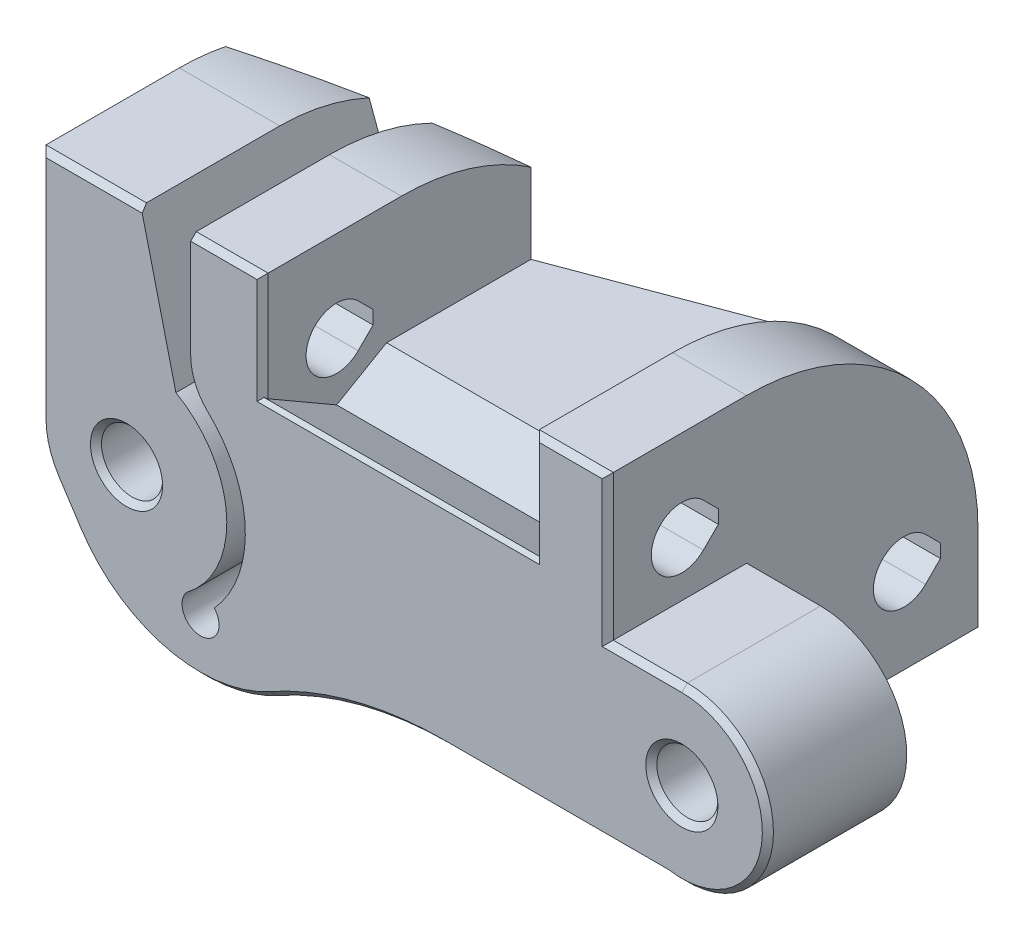
from build123d import *
from OCP.BRepFilletAPI import BRepFilletAPI_MakeChamfer

# Parameters (mm, degrees)
SKETCH1_R                = 1.65
BOSS_EXTRUDE1_DEPTH      = 20
SKETCH3_R                = 1.65
CUT_EXTRUDE3_DEPTH       = 39.673925324
CUT_EXTRUDE4_DEPTH       = 12
CUT_EXTRUDE5_START       = -4
CUT_EXTRUDE5_DEPTH       = 14.65
CUT_EXTRUDE11_DEPTH      = 42.915062925
CUT_EXTRUDE11_DEPTH_BACK = 42.915062925
CUT_EXTRUDE10_DEPTH      = 5
CUT_EXTRUDE10_DEPTH_BACK = 39.898875305
SKETCH10_W               = 9.115200733
SKETCH10_H               = 9.576012389
CUT_EXTRUDE7_DEPTH       = 4.5
CUT_EXTRUDE8_DEPTH       = 36.587532929
CUT_EXTRUDE8_DEPTH_BACK  = 36.587532929
SKETCH8_R                = 1.65
CUT_EXTRUDE9_START       = 2
SKETCH9_R                = 3.5
CUT_EXTRUDE9_DEPTH       = 34.587532929
CHAMFER6_SIZE            = 1.8
CUT_EXTRUDE12_DEPTH      = 39.673925324
CHAMFER7_SIZE            = 0.3
CHAMFER7_SIZE2           = 0.219615242
CUT_EXTRUDE13_DEPTH      = 42.915062925
SKETCH14_R               = 3.1
CUT_EXTRUDE14_DEPTH      = 1.8
CHAMFER8_START           = -4.6500001
CHAMFER8_OUTLINE_R       = 3.1
CHAMFER8_DEPTH           = 1.8000001
CHAMFER8_START_2         = -4.65
CHAMFER8_3_DEPTH         = 1.8
FILLET1_R                = 3


with BuildPart() as part:
    # Sketch1 → Boss-Extrude1 (new body)
    with BuildSketch(Plane.XY):
        with BuildLine():
            Line((-3.894375, -2.540933561), (-2.7, -4.371498599))
            ThreePointArc((-2.7, -4.371498599), (2.076657931, -7.765356095), (7.885150706, -6.993254178))
            ThreePointArc((7.885150706, -6.993254178), (12.369935761, -5.200285461), (17.161085198, -4.589612979))
            Line((17.161085198, -4.589612979), (29.253037683, -4.589612979))
            ThreePointArc((29.253037683, -4.589612979), (34.634878658, -0.374699645), (30, 4.65))
            Line((30, 4.65), (26, 4.65))
            Line((26, 4.65), (26, 12.5))
            Line((26, 12.5), (-4.65, 12.5))
            Line((-4.65, 12.5), (-4.65, 0))
            ThreePointArc((-4.65, 0), (-4.457092312, -1.325453932), (-3.894375, -2.540933561))
        make_face()
        Circle(SKETCH1_R, mode=Mode.SUBTRACT)
        with Locations((30, 0)):
            Circle(SKETCH1_R, mode=Mode.SUBTRACT)
    extrude(amount=BOSS_EXTRUDE1_DEPTH)

    # Sketch3 → Cut-Extrude3 (cut, through all)
    with BuildSketch(Plane(origin=(26, 0, 0), x_dir=(0, 0, -1), z_dir=(1, 0, 0))):
        with Locations(Location((-16, 7.6, 0), (0, 0, 90))):
            Circle(SKETCH3_R)
    extrude(amount=-CUT_EXTRUDE3_DEPTH, mode=Mode.SUBTRACT)

    # Sketch4 → Cut-Extrude4 (cut)
    with BuildSketch(Plane(origin=(0, 0, 0), x_dir=(-1, 0, 0), z_dir=(0, 0, -1))):
        Polygon((1.58771324, -2.75), (6.896922601, -2.75), (6.896922601, 2.75), (1.58771324, 2.75), (-1.58771324, 2.75), (-3.175426481, 0), (-1.58771324, -2.75), align=None)
    extrude(amount=-CUT_EXTRUDE4_DEPTH, mode=Mode.SUBTRACT)

    # Sketch5 → Cut-Extrude5 (cut)
    with BuildSketch(Plane(origin=(26, 0, 0), x_dir=(0, 0, -1), z_dir=(1, 0, 0)).offset(CUT_EXTRUDE5_START)):
        Polygon((-13.3, 6.041154273), (0, 6.041154273), (0, 12.5), (-20, 13.02709253), (-20, 6.791709623), (-16, 4.482308546), align=None)
    extrude(amount=-CUT_EXTRUDE5_DEPTH, mode=Mode.SUBTRACT)

    # Sketch11 → Cut-Extrude11 (cut, two sides: drawn at the far end of the back side and taken through both)
    with BuildSketch(Plane(origin=(0, 0, 0), x_dir=(1, 0, 0), z_dir=(0, 1, 0)).offset(-CUT_EXTRUDE11_DEPTH_BACK)):
        Polygon((22, 0), (-4.65, -10), (-4.65, 0), align=None)
    extrude(amount=CUT_EXTRUDE11_DEPTH + CUT_EXTRUDE11_DEPTH_BACK, mode=Mode.SUBTRACT)

    # Sketch10 → Cut-Extrude10 (cut, two sides: drawn at the far end of the back side and taken through both)
    with BuildSketch(Plane.XY.offset(7.5).offset(-CUT_EXTRUDE10_DEPTH_BACK)):
        with Locations((30.557600367, -0.138006194)):
            Rectangle(SKETCH10_W, SKETCH10_H)
    extrude(amount=CUT_EXTRUDE10_DEPTH + CUT_EXTRUDE10_DEPTH_BACK, mode=Mode.SUBTRACT)

    # Sketch7 → Cut-Extrude7 (cut)
    with BuildSketch(Plane(origin=(0, 0, 12.5), x_dir=(-1, 0, 0), z_dir=(0, 0, -1))):
        Polygon((-27.2, -1.616580754), (-27.2, 1.616580754), (-30, 3.233161507), (-32.8, 1.616580754), (-32.8, -1.616580754), (-30, -3.233161507), align=None)
    extrude(amount=-CUT_EXTRUDE7_DEPTH, mode=Mode.SUBTRACT)

    # Sketch8 → Cut-Extrude8 (cut, two sides: drawn at the far end of the back side and taken through both)
    with BuildSketch(Plane.ZY.offset(-22).offset(-CUT_EXTRUDE8_DEPTH_BACK)):
        with Locations((4, 0)):
            Circle(SKETCH8_R)
        with BuildLine():
            Line((12.5, 12.5), (0, 12.5))
            Line((0, 12.5), (0, 0))
            ThreePointArc((0, 0), (3.661165235, 8.838834765), (12.5, 12.5))
        make_face()
    extrude(amount=CUT_EXTRUDE8_DEPTH + CUT_EXTRUDE8_DEPTH_BACK, mode=Mode.SUBTRACT)

    # Sketch9 → Cut-Extrude9 (cut, through all)
    with BuildSketch(Plane.ZY.offset(-22).offset(CUT_EXTRUDE9_START)):
        with Locations((4, 0)):
            Circle(SKETCH9_R)
    extrude(amount=CUT_EXTRUDE9_DEPTH, mode=Mode.SUBTRACT)

    # Chamfer6
    # the kernel refuses this chamfer: 1.8 mm, written as the material it takes off along each edge
    with BuildSketch(Plane(origin=(20, 0, 4), x_dir=(0, 0, 1), z_dir=(0, -1, 0))) as chamfer6_piece_1:
        Polygon((1.65, -CHAMFER6_SIZE), (1.65 + CHAMFER6_SIZE, 0), (1.65, 0), align=None)
    revolve(axis=Axis((20, 0, 4), (-1, 0, 0)), mode=Mode.SUBTRACT)

    # Sketch12 → Cut-Extrude12 (cut, through all)
    with BuildSketch(Plane(origin=(26, 0, 0), x_dir=(0, 0, -1), z_dir=(1, 0, 0))):
        Polygon((-4, 0), (-2.833273811, -1.166726189), (-2.03, -0.363452378), (-2.03, 0.363452378), (-2.833273811, 1.166726189), align=None)
        Polygon((-16, 7.6), (-14.833273811, 6.433273811), (-14.03, 7.236547622), (-14.03, 7.963452378), (-14.833273811, 8.766726189), align=None)
    extrude(amount=-CUT_EXTRUDE12_DEPTH, mode=Mode.SUBTRACT)

    # Chamfer7: one chamfer whose edges measure the first distance from different faces: ONE call of the kernel's chamfer builder (chamfer() names one face for all edges)
    chamfer7_edges_1 = [part.edges().sort_by_distance(p)[0] for p in [
        (-4.457092312, -1.325453932, 20),
        (-3.2971875, -3.45621608, 20),
        (2.076657931, -7.765356095, 20),
        (12.369935761, -5.200285461, 20),
        (23.207061441, -4.589612979, 20),
        (34.634878658, -0.374699645, 20),
        (-1.65, 0, 20),
        (28, 4.65, 20),
        (28.35, 0, 20),
        (26, 8.575, 20),
        (24, 12.5, 20),
        (-4.65, 6.25, 20),
        (1.35, 12.5, 20),
        (22, 9.645854812, 20),
        (7.35, 9.645854812, 20),
    ]]
    chamfer7_edges_2 = [part.edges().sort_by_distance(p)[0] for p in [
        (14.675, 6.791709623, 20),
    ]]
    chamfer7_side_2 = [part.faces().sort_by_distance(p)[0] for p in [
        (12.200528513, 2.041085784, 20),
    ]]
    chamfer7 = BRepFilletAPI_MakeChamfer(part.part.solid().wrapped)
    for e in chamfer7_edges_1:
        chamfer7.Add(CHAMFER7_SIZE, e.wrapped)
    for e in chamfer7_edges_2:
        chamfer7.Add(CHAMFER7_SIZE, CHAMFER7_SIZE2, e.wrapped, chamfer7_side_2[0].wrapped)  # the first distance lies on this face
    add(Compound.cast(chamfer7.Shape()), mode=Mode.REPLACE)

    # Sketch13 → Cut-Extrude13 (cut, through all)
    with BuildSketch(Plane.XY.offset(20)):
        with BuildLine():
            Line((2.668200105, 13.768506402), (3.468200105, 13.768506402))
            Line((3.468200105, 13.768506402), (3.468200105, 5.400266455))
            ThreePointArc((3.468200105, 5.400266455), (6.363895276, 0.831941508), (4.739860969, -4.327240201))
            ThreePointArc((4.739860969, -4.327240201), (4, -6), (3.260139031, -4.327240201))
            ThreePointArc((3.260139031, -4.327240201), (5.406317163, 0.353905339), (2.668200105, 4.715317853))
            Line((2.668200105, 4.715317853), (0.468200105, 13.768506402))
            Line((0.468200105, 13.768506402), (2.668200105, 13.768506402))
        make_face()
    extrude(amount=-CUT_EXTRUDE13_DEPTH, mode=Mode.SUBTRACT)

    # Sketch14 → Cut-Extrude14 (cut)
    with BuildSketch(Plane.ZY.offset(4.65)):
        with Locations(Location((16, 7.6, 0), (0, 0, 270))):
            Circle(SKETCH14_R)
    extrude(amount=-CUT_EXTRUDE14_DEPTH, mode=Mode.SUBTRACT)

    # Chamfer8: read off the stored shape, not the designer's step
    # Chamfer8 outline → Chamfer8 (add)
    with BuildSketch(Plane.YZ.offset(CHAMFER8_START)):
        with Locations((7.6, 16)):
            Circle(CHAMFER8_OUTLINE_R)
    extrude(amount=CHAMFER8_DEPTH)

    # Chamfer8 2 outline → Chamfer8 2 (revolve, cut)
    with BuildSketch(Plane(origin=(0, 7.6, 16), x_dir=(0, 1, 0), z_dir=(0, 0, -1))):
        Polygon((0, -4.65), (3.1, -4.65), (1.64999615, -3.19999615), (0, -3.19999615), align=None)
    revolve(axis=Axis((0, 7.6, 16), (1, 0, 0)), mode=Mode.SUBTRACT)

    # Chamfer8 3 outline → Chamfer8 3 (cut)
    with BuildSketch(Plane.YZ.offset(CHAMFER8_START_2)):
        with BuildLine():
            ThreePointArc((8.766726189, 14.833273811), (7.6, 17.65), (6.433273811, 14.833273811))
            Line((6.433273811, 14.833273811), (7.236547622, 14.03))
            Line((7.236547622, 14.03), (7.963452378, 14.03))
            Line((7.963452378, 14.03), (8.766726189, 14.833273811))
        make_face()
    extrude(amount=CHAMFER8_3_DEPTH, mode=Mode.SUBTRACT)

    # Fillet1
    # the kernel refuses this fillet: 3 mm, written as the material it takes off along each edge
    with BuildSketch(Plane(origin=(3.468200105, 5.400266455, 23.613279493), x_dir=(0.7875480221604082, -0.616253286231586, 0), z_dir=(0, 0, -1))) as fillet1_piece_1:
        with BuildLine():
            CenterArc((1.471965922, -2.987012306), FILLET1_R, 95.333346889, 46.623610266)
            Line((-0.890678145, -1.138252447), (0, 0))
            ThreePointArc((0, 0), (0.596557816, -0.027785198), (1.193115632, 0))
        make_face()
    extrude(amount=20.272787919, mode=Mode.SUBTRACT)


solid = part.part
